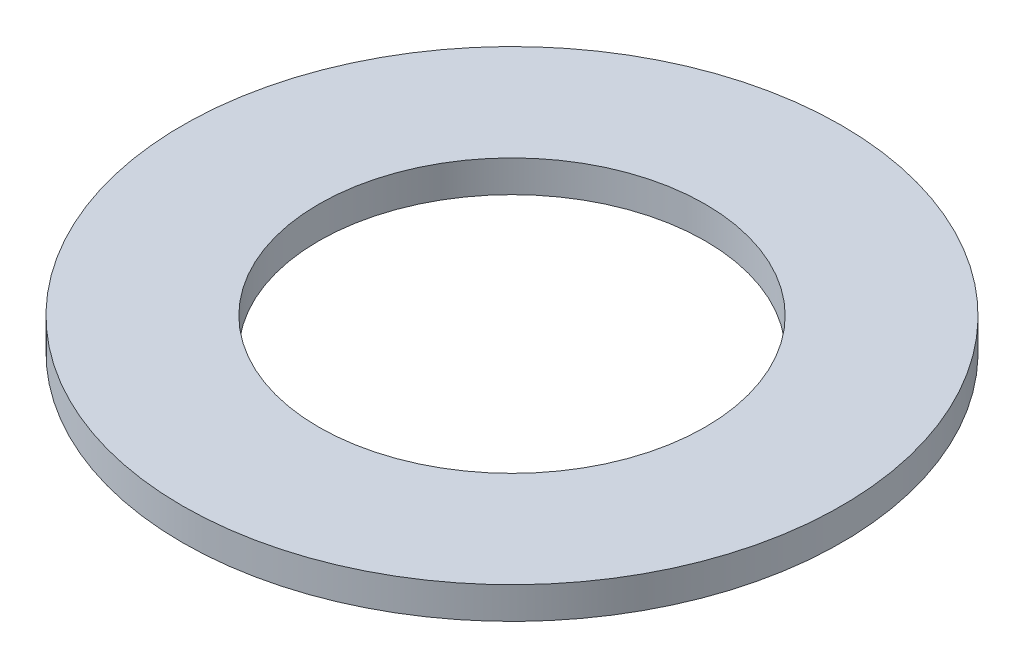
from build123d import *

# Parameters (mm, degrees)
SKETCH1_R           = 72.5
BOSS_EXTRUDE1_DEPTH = 7
SKETCH2_R           = 42.5
CUT_EXTRUDE1_DEPTH  = 103.769158798


with BuildPart() as part:
    # Sketch1 → Boss-Extrude1 (new body)
    with BuildSketch(Plane(origin=(0, 0, 0), x_dir=(1, 0, 0), z_dir=(0, 1, 0))):
        Circle(SKETCH1_R)
    extrude(amount=BOSS_EXTRUDE1_DEPTH)

    # Sketch2 → Cut-Extrude1 (cut, through all)
    with BuildSketch(Plane(origin=(0, 0, 0), x_dir=(1, 0, 0), z_dir=(0, 1, 0))):
        Circle(SKETCH2_R)
    extrude(amount=CUT_EXTRUDE1_DEPTH, mode=Mode.SUBTRACT)


solid = part.part
